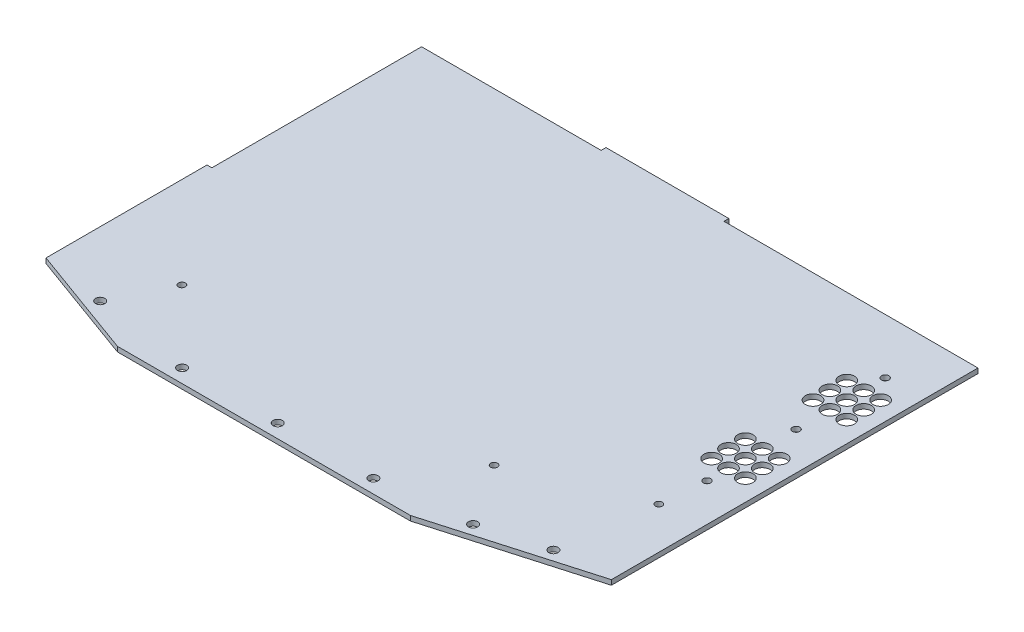
from build123d import *

# Parameters (mm, degrees)
SKETCH1_W               = 308.1112
SKETCH1_H               = 3.175
BOSS_EXTRUDE1_DEPTH     = 267.83
SKETCH3_W               = 267.83
SKETCH3_H               = 3.175
BOSS_EXTRUDE3_DEPTH     = 3.175
SKETCH4_W               = 50.87366
SKETCH4_H               = 3.175
BOSS_EXTRUDE4_DEPTH     = 267.83
CUT_EXTRUDE1_DEPTH      = 340.190761306
CUT_EXTRUDE3_DEPTH      = 340.190761306
SKETCH17_W              = 105.930619964
SKETCH17_H              = 3.175
BOSS_EXTRUDE5_DEPTH     = 3.175
CUT_EXTRUDE7_DEPTH      = 340.190761306
CUT_EXTRUDE7_DEPTH_BACK = 340.190761306
SKETCH25_R              = 3
CUT_EXTRUDE8_DEPTH      = 3.175
SKETCH27_R              = 5
CUT_EXTRUDE9_DEPTH      = 340.190761306
M4_CLEARANCE_HOLE1_D    = 4.5
SKETCH30_W              = 80
SKETCH30_H              = 3.175
BOSS_EXTRUDE6_DEPTH     = 3.175
SKETCH31_R              = 2.4
CUT_EXTRUDE10_DEPTH     = 340.190761306
LPATTERN1_COUNT         = 3
LPATTERN1_PITCH         = 58


with BuildPart() as part:
    # Sketch1 → Boss-Extrude1 (new body)
    with BuildSketch(Plane.XY):
        Rectangle(SKETCH1_W, SKETCH1_H)
    extrude(amount=BOSS_EXTRUDE1_DEPTH)

    # Sketch3 → Boss-Extrude3 (add)
    with BuildSketch(Plane(origin=(154.0556, 0, 0), x_dir=(0, 0, -1), z_dir=(1, 0, 0))):
        with Locations((-133.915, 0)):
            Rectangle(SKETCH3_W, SKETCH3_H)
    extrude(amount=BOSS_EXTRUDE3_DEPTH)

    # Sketch4 → Boss-Extrude4 (add)
    with BuildSketch(Plane.XY.offset(267.83)):
        with Locations((182.66743, 0)):
            Rectangle(SKETCH4_W, SKETCH4_H)
    extrude(amount=-BOSS_EXTRUDE4_DEPTH)

    # Sketch6 → Cut-Extrude1 (cut, through all)
    with BuildSketch(Plane(origin=(0, 1.5875, 0), x_dir=(1, 0, 0), z_dir=(0, 1, 0))):
        Polygon((208.10426, -238.620139294), (106.50426, -267.83), (208.10426, -267.83), align=None)
    extrude(amount=-CUT_EXTRUDE1_DEPTH, mode=Mode.SUBTRACT)

    # Sketch11 → Cut-Extrude3 (cut, through all)
    with BuildSketch(Plane.XZ.offset(1.5875)):
        Polygon((-154.0556, 242.43), (-84.2056, 267.83), (-154.0556, 267.83), align=None)
    extrude(amount=-CUT_EXTRUDE3_DEPTH, mode=Mode.SUBTRACT)

    # Sketch17 → Boss-Extrude5 (add)
    with BuildSketch(Plane.ZY.offset(154.0556)):
        with Locations((189.464690018, 0)):
            Rectangle(SKETCH17_W, SKETCH17_H)
    extrude(amount=BOSS_EXTRUDE5_DEPTH)

    # Sketch23 → Cut-Extrude7 (cut, two sides: drawn at the far end of the back side and taken through both)
    with BuildSketch(Plane(origin=(0, 1.5875, 0), x_dir=(1, 0, 0), z_dir=(0, 1, 0)).offset(-CUT_EXTRUDE7_DEPTH_BACK)):
        Polygon((678.256720653, -545.089025692), (-154.0556, -242.43), (-157.2306, -241.275454545), (-989.542920653, 61.383571147), (-1594.860972038, -1603.24107016), (72.938669269, -2209.713666999), align=None)
    extrude(amount=CUT_EXTRUDE7_DEPTH + CUT_EXTRUDE7_DEPTH_BACK, mode=Mode.SUBTRACT)

    # Sketch25 → Cut-Extrude8 (cut)
    with BuildSketch(Plane.XZ.offset(1.5875)):
        with Locations((-115.3206, 247.915394364)):
            Circle(SKETCH25_R)
        with Locations((-50.97574, 258.94)):
            Circle(SKETCH25_R)
        with Locations((11.25426, 258.94)):
            Circle(SKETCH25_R)
        with Locations((73.48426, 258.94)):
            Circle(SKETCH25_R)
        with Locations((172.54426, 240.761310541)):
            Circle(SKETCH25_R)
        with Locations((131.90426, 252.445254824)):
            Circle(SKETCH25_R)
    extrude(amount=-CUT_EXTRUDE8_DEPTH, mode=Mode.SUBTRACT)

    # Sketch27 → Cut-Extrude9 (cut, through all)
    with BuildSketch(Plane.XZ.offset(1.5875)):
        with Locations((172.48674, 137.774823778)):
            Circle(SKETCH27_R)
        with Locations((183.48674, 137.774823778)):
            Circle(SKETCH27_R)
        with Locations((194.48674, 137.774823778)):
            Circle(SKETCH27_R)
        with Locations((194.48674, 126.774823778)):
            Circle(SKETCH27_R)
        with Locations((194.48674, 115.774823778)):
            Circle(SKETCH27_R)
        with Locations((183.48674, 126.774823778)):
            Circle(SKETCH27_R)
        with Locations((183.48674, 115.774823778)):
            Circle(SKETCH27_R)
        with Locations((172.48674, 115.774823778)):
            Circle(SKETCH27_R)
        with Locations((172.48674, 126.774823778)):
            Circle(SKETCH27_R)
        with Locations((194.48674, 71.774823778)):
            Circle(SKETCH27_R)
        with Locations((194.48674, 60.774823778)):
            Circle(SKETCH27_R)
        with Locations((194.48674, 49.774823778)):
            Circle(SKETCH27_R)
        with Locations((183.48674, 71.774823778)):
            Circle(SKETCH27_R)
        with Locations((183.48674, 60.774823778)):
            Circle(SKETCH27_R)
        with Locations((183.48674, 49.774823778)):
            Circle(SKETCH27_R)
        with Locations((172.48674, 49.774823778)):
            Circle(SKETCH27_R)
        with Locations((172.48674, 60.774823778)):
            Circle(SKETCH27_R)
        with Locations((172.48674, 71.774823778)):
            Circle(SKETCH27_R)
    extrude(amount=-CUT_EXTRUDE9_DEPTH, mode=Mode.SUBTRACT)

    # M4 Clearance Hole1 (through all)
    with Locations(Plane.XZ.offset(1.5875)):
        with Locations((180.96500002, 180.586), (105.42905, 212.2849914), (-97.77095, 212.2849914)):
            Hole(M4_CLEARANCE_HOLE1_D / 2)

    # Sketch30 → Boss-Extrude6 (add)
    with BuildSketch(Plane(origin=(0, 0, 0), x_dir=(-1, 0, 0), z_dir=(0, 0, -1))):
        with Locations((-2.78399998, 0)):
            Rectangle(SKETCH30_W, SKETCH30_H)
    extrude(amount=BOSS_EXTRUDE6_DEPTH)

    # Sketch31 → Cut-Extrude10 (cut, symmetric)
    with BuildSketch(Plane.XZ.offset(1.5875)):
        with Locations((183.48674, 151.774823778)):
            Circle(SKETCH31_R)
    cut_extrude10 = extrude(amount=CUT_EXTRUDE10_DEPTH, both=True, mode=Mode.SUBTRACT)

    # LPattern1: Cut-Extrude10 ×3
    with Locations(*[(0, 0, -i * LPATTERN1_PITCH) for i in range(1, LPATTERN1_COUNT)]):
        add(cut_extrude10, mode=Mode.SUBTRACT)


solid = part.part
